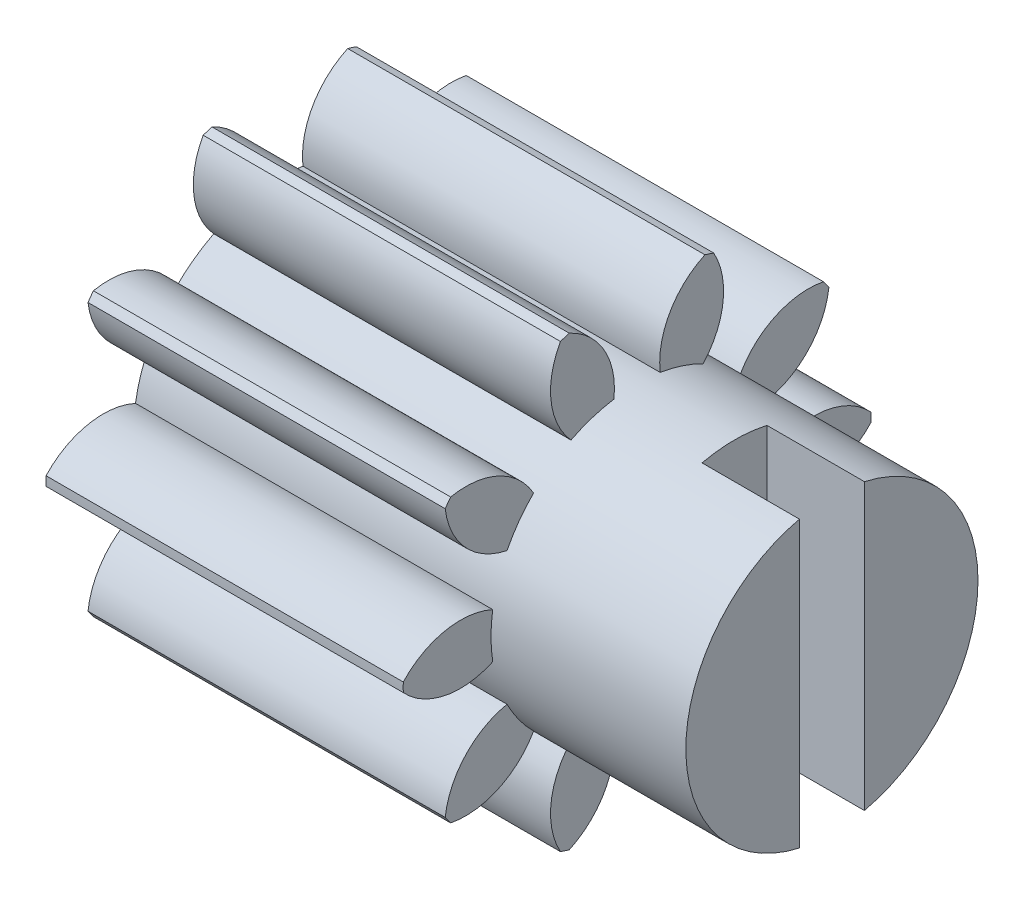
from build123d import *

# Parameters (mm, degrees)
BASPROSKE_W         = 5.5
BASPROSKE_H         = 3.6
TOOTHCUT_DEPTH      = 8.494664769
TEETHCUTS_COUNT     = 10
TEETHCUTS_ANGLE     = 324
BORSKE_R            = 0.5
BORE_DEPTH          = 50.0000508
SKETCH_1_R          = 2.249
SKETCH_1_R_2        = 0.5
EXTRUDE_1_DEPTH     = 3
CUT_EXTRUDE_START   = -1.5
CUT_EXTRUDE_1_DEPTH = 1.5


with BuildPart() as part:
    # BasProSke → Base-Revolve (revolve)
    with BuildSketch(Plane(origin=(0, 0, 0), x_dir=(1, 0, 0), z_dir=(0, 1, 0))):
        with Locations((2.75, 1.8)):
            Rectangle(BASPROSKE_W, BASPROSKE_H)
    revolve(axis=Axis((-10, 0, 0), (1, 0, 0)))

    # TooCutSke → ToothCut (cut, through all)
    with BuildSketch(Plane(origin=(0, 0, 0), x_dir=(0, 0, -1), z_dir=(1, 0, 0))):
        with BuildLine():
            ThreePointArc((0.355978269, 2.22064866), (0, 2.249), (-0.355978269, 2.22064866))
            ThreePointArc((-0.355978269, 2.22064866), (-0.512117582, 2.960985626), (-1.080212515, 3.460732015))
            ThreePointArc((-1.080212515, 3.460732015), (0, 3.6254), (1.080212515, 3.460732015))
            ThreePointArc((1.080212515, 3.460732015), (0.512117582, 2.960985626), (0.355978269, 2.22064866))
        make_face()
    toothcut = extrude(amount=TOOTHCUT_DEPTH, mode=Mode.SUBTRACT)

    # TeethCuts: ToothCut ×10 about axis
    teethcuts_axis = Axis((-10, 0, 0), (1, 0, 0))
    for i in range(1, TEETHCUTS_COUNT):
        add(toothcut.rotate(teethcuts_axis, i * TEETHCUTS_ANGLE / (TEETHCUTS_COUNT - 1)), mode=Mode.SUBTRACT)

    # BorSke → Bore (cut, symmetric)
    with BuildSketch(Plane(origin=(0, 0, 0), x_dir=(0, 0, -1), z_dir=(1, 0, 0))):
        Circle(BORSKE_R)
    extrude(amount=BORE_DEPTH, both=True, mode=Mode.SUBTRACT)

    # 草图1 → 凸台-拉伸1 (add)
    with BuildSketch(Plane(origin=(5.5, 0, 0), x_dir=(0, 0, -1), z_dir=(1, 0, 0))):
        Circle(SKETCH_1_R)
        Circle(SKETCH_1_R_2, mode=Mode.SUBTRACT)
    extrude(amount=EXTRUDE_1_DEPTH)

    # 草图2 → 切除-拉伸1 (cut)
    with BuildSketch(Plane(origin=(8.5, 0, 0), x_dir=(0, 0, -1), z_dir=(1, 0, 0)).offset(CUT_EXTRUDE_START)):
        with BuildLine():
            Line((-0.5, 0), (-0.5, -2.19271544))
            ThreePointArc((-0.5, -2.19271544), (0, -2.249), (0.5, -2.19271544))
            Line((0.5, -2.19271544), (0.5, 0))
            Line((0.5, 0), (0.5, 2.19271544))
            ThreePointArc((0.5, 2.19271544), (0, 2.249), (-0.5, 2.19271544))
            Line((-0.5, 2.19271544), (-0.5, 0))
        make_face()
    extrude(amount=CUT_EXTRUDE_1_DEPTH, mode=Mode.SUBTRACT)


solid = part.part
